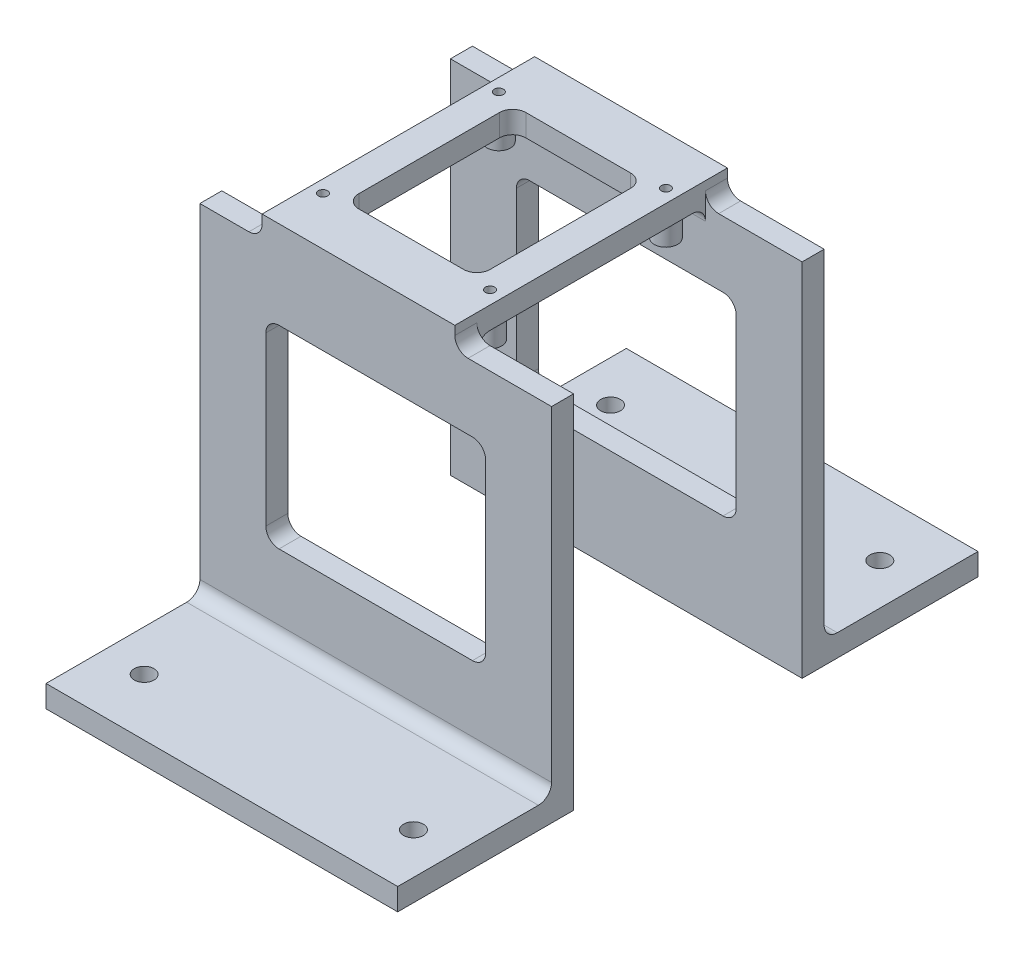
from build123d import *

# Parameters (mm, degrees)
SKETCH1_W               = 80
SKETCH1_H               = 40
SKETCH1_R               = 2.25
BOSS_EXTRUDE1_DEPTH     = 5
BOSS_EXTRUDE1_2_DEPTH   = 5
SKETCH2_W               = 80
SKETCH2_H               = 5
BOSS_EXTRUDE2_DEPTH     = 77.05
SKETCH3_W               = 43.85
SKETCH3_H               = 62
BOSS_EXTRUDE3_DEPTH     = 5
SKETCH5_W               = 29.85
SKETCH5_H               = 38
CUT_EXTRUDE2_DEPTH      = 10
CUT_EXTRUDE1_REACH      = 118.334
SKETCH4_R               = 1.05
FILLET1_R               = 3
FILLET2_R               = 3
CUT_EXTRUDE3_DEPTH      = 137.333057253
CUT_EXTRUDE3_DEPTH_BACK = 137.333057253
SKETCH6_W               = 50
SKETCH6_H               = 44.05
FILLET3_R               = 3
SKETCH9_R               = 2.65
SKETCH9_R_2             = 1.05
BOSS_EXTRUDE5_DEPTH     = 4.75


with BuildPart() as part:
    # Sketch1 → Boss-Extrude1 (new body)
    with BuildSketch(Plane(origin=(0, 0, 0), x_dir=(1, 0, 0), z_dir=(0, 1, 0))):
        with Locations((0, 46)):
            Rectangle(SKETCH1_W, SKETCH1_H)
        with Locations((-30.625, 53.044055982)):
            Circle(SKETCH1_R, mode=Mode.SUBTRACT)
        with Locations((30.625, 53.044055982)):
            Circle(SKETCH1_R, mode=Mode.SUBTRACT)
    extrude(amount=BOSS_EXTRUDE1_DEPTH)



with BuildPart() as body_2:
    # Sketch1 → Boss-Extrude1 2 (new body)
    with BuildSketch(Plane(origin=(0, 0, 0), x_dir=(1, 0, 0), z_dir=(0, 1, 0))):
        with Locations((0, -46)):
            Rectangle(SKETCH1_W, SKETCH1_H)
        with Locations((30.625, -53.044055982)):
            Circle(SKETCH1_R, mode=Mode.SUBTRACT)
        with Locations((-30.625, -53.044055982)):
            Circle(SKETCH1_R, mode=Mode.SUBTRACT)
    extrude(amount=BOSS_EXTRUDE1_2_DEPTH)


with BuildPart() as part_1:
    add(part.part)

    add(body_2.part)  # Boss-Extrude2 merges body 2
    # Sketch2 → Boss-Extrude2 (add)
    with BuildSketch(Plane(origin=(0, 5, 0), x_dir=(1, 0, 0), z_dir=(0, 1, 0))):
        with Locations((0, 28.5)):
            Rectangle(SKETCH2_W, SKETCH2_H)
        with Locations((0, -28.5)):
            Rectangle(SKETCH2_W, SKETCH2_H)
    extrude(amount=BOSS_EXTRUDE2_DEPTH)

    # Sketch3 → Boss-Extrude3 (add)
    with BuildSketch(Plane(origin=(0, 82.05, 0), x_dir=(1, 0, 0), z_dir=(0, 1, 0))):
        with Locations((-3.925, 0)):
            Rectangle(SKETCH3_W, SKETCH3_H)
    extrude(amount=BOSS_EXTRUDE3_DEPTH)

    # Sketch5 → Cut-Extrude2 (cut)
    with BuildSketch(Plane.XZ.offset(-82.05)):
        with Locations((-3.925, 0)):
            Rectangle(SKETCH5_W, SKETCH5_H)
    extrude(amount=-CUT_EXTRUDE2_DEPTH, mode=Mode.SUBTRACT)

    # Sketch4 → Cut-Extrude1 (cut, up to next)
    with BuildSketch(Plane(origin=(0, 87.05, 0), x_dir=(1, 0, 0), z_dir=(0, 1, 0)), mode=Mode.PRIVATE) as cut_extrude1_sk1:
        with Locations((-23, 20)):
            Circle(SKETCH4_R)
    cut_extrude1_tool1 = extrude(cut_extrude1_sk1.sketch, amount=-CUT_EXTRUDE1_REACH, mode=Mode.PRIVATE) & part_1.part
    # Sketch4 → Cut-Extrude1 (cut, up to next)
    with BuildSketch(Plane(origin=(0, 87.05, 0), x_dir=(1, 0, 0), z_dir=(0, 1, 0)), mode=Mode.PRIVATE) as cut_extrude1_sk2:
        with Locations((15, 20)):
            Circle(SKETCH4_R)
    cut_extrude1_tool2 = extrude(cut_extrude1_sk2.sketch, amount=-CUT_EXTRUDE1_REACH, mode=Mode.PRIVATE) & part_1.part
    # Sketch4 → Cut-Extrude1 (cut, up to next)
    with BuildSketch(Plane(origin=(0, 87.05, 0), x_dir=(1, 0, 0), z_dir=(0, 1, 0)), mode=Mode.PRIVATE) as cut_extrude1_sk3:
        with Locations((15, -20)):
            Circle(SKETCH4_R)
    cut_extrude1_tool3 = extrude(cut_extrude1_sk3.sketch, amount=-CUT_EXTRUDE1_REACH, mode=Mode.PRIVATE) & part_1.part
    # Sketch4 → Cut-Extrude1 (cut, up to next)
    with BuildSketch(Plane(origin=(0, 87.05, 0), x_dir=(1, 0, 0), z_dir=(0, 1, 0)), mode=Mode.PRIVATE) as cut_extrude1_sk4:
        with Locations((-23, -20)):
            Circle(SKETCH4_R)
    cut_extrude1_tool4 = extrude(cut_extrude1_sk4.sketch, amount=-CUT_EXTRUDE1_REACH, mode=Mode.PRIVATE) & part_1.part
    add(cut_extrude1_tool1.solids().sort_by_distance((-23, 87.05, -20))[0], mode=Mode.SUBTRACT)
    add(cut_extrude1_tool2.solids().sort_by_distance((15, 87.05, -20))[0], mode=Mode.SUBTRACT)
    add(cut_extrude1_tool3.solids().sort_by_distance((15, 87.05, 20))[0], mode=Mode.SUBTRACT)
    add(cut_extrude1_tool4.solids().sort_by_distance((-23, 87.05, 20))[0], mode=Mode.SUBTRACT)

    # Fillet1
    fillet1_edges = [part_1.edges().sort_by_distance(p)[0] for p in [
        (-3.925, 82.05, -26),
        (-3.925, 82.05, 26),
        (0, 5, -31),
        (0, 5, 31),
    ]]
    fillet(fillet1_edges, radius=FILLET1_R)

    # Fillet2
    fillet2_edges = [part_1.edges().sort_by_distance(p)[0] for p in [
        (18, 82.05, -28.5),
        (-25.85, 82.05, -28.5),
        (-25.85, 82.05, 28.5),
        (18, 82.05, 28.5),
    ]]
    fillet(fillet2_edges, radius=FILLET2_R)

    # Sketch6 → Cut-Extrude3 (cut, two sides: drawn at the far end of the back side and taken through both)
    with BuildSketch(Plane.XY.offset(31).offset(-CUT_EXTRUDE3_DEPTH_BACK)):
        with Locations((0, 45.025)):
            Rectangle(SKETCH6_W, SKETCH6_H)
    extrude(amount=CUT_EXTRUDE3_DEPTH + CUT_EXTRUDE3_DEPTH_BACK, mode=Mode.SUBTRACT)

    # Fillet3
    fillet3_edges = [part_1.edges().sort_by_distance(p)[0] for p in [
        (-25, 67.05, -28.5),
        (25, 67.05, -28.5),
        (25, 23, -28.5),
        (-25, 23, -28.5),
        (-25, 67.05, 28.5),
        (25, 67.05, 28.5),
        (25, 23, 28.5),
        (-25, 23, 28.5),
        (-18.85, 84.55, -19),
        (-18.85, 84.55, 19),
        (11, 84.55, 19),
        (11, 84.55, -19),
    ]]
    fillet(fillet3_edges, radius=FILLET3_R)

    # Sketch9 → Boss-Extrude5 (add)
    # profile 1 of 4: a face of its own
    with BuildSketch(Plane.XZ.offset(-82.05)):
        with Locations((-23, 20)):
            Circle(SKETCH9_R)
        with Locations((-23, 20)):
            Circle(SKETCH9_R_2, mode=Mode.SUBTRACT)
    # profile 2 of 4: a face of its own
    with BuildSketch(Plane.XZ.offset(-82.05)):
        with Locations((-23, -20)):
            Circle(SKETCH9_R)
        with Locations((-23, -20)):
            Circle(SKETCH9_R_2, mode=Mode.SUBTRACT)
    # profile 3 of 4: a face of its own
    with BuildSketch(Plane.XZ.offset(-82.05)):
        with Locations((15, 20)):
            Circle(SKETCH9_R)
        with Locations((15, 20)):
            Circle(SKETCH9_R_2, mode=Mode.SUBTRACT)
    # profile 4 of 4: a face of its own
    with BuildSketch(Plane.XZ.offset(-82.05)):
        with Locations((15, -20)):
            Circle(SKETCH9_R)
        with Locations((15, -20)):
            Circle(SKETCH9_R_2, mode=Mode.SUBTRACT)
    extrude(amount=BOSS_EXTRUDE5_DEPTH)


solid = part_1.part
